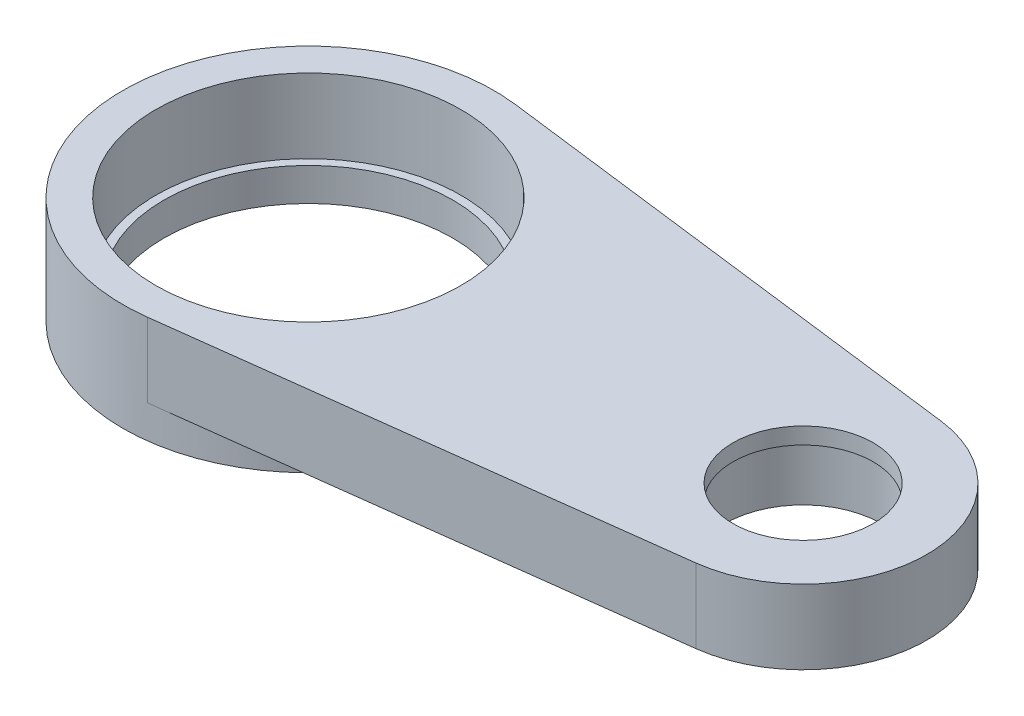
from build123d import *

# Parameters (mm, degrees)
SKETCH_1_R           = 22.5
SKETCH_1_R_2         = 17.5
EXTRUDE_1_DEPTH      = 8
SKETCH_2_R           = 22.5
SKETCH_2_R_2         = 18.5
EXTRUDE_2_DEPTH      = 5
EXTRUDE_START        = -9
EXTRUDE_3_DEPTH      = 9
CUT_EXTRUDE_START    = -4
SKETCH_7_R           = 18.5
CUT_EXTRUDE_4_DEPTH  = 4
SKETCH_13_R          = 9.5
CUT_EXTRUDE_9_DEPTH  = 7
SKETCH_14_R          = 8.5
CUT_EXTRUDE_10_DEPTH = 80.071170473


with BuildPart() as part:
    # 스케치1 → 보스-돌출1 (new body)
    with BuildSketch(Plane(origin=(0, 0, 0), x_dir=(1, 0, 0), z_dir=(0, 1, 0))):
        Circle(SKETCH_1_R)
        Circle(SKETCH_1_R_2, mode=Mode.SUBTRACT)
    extrude(amount=EXTRUDE_1_DEPTH)

    # 스케치2 → 보스-돌출2 (add)
    with BuildSketch(Plane(origin=(0, 8, 0), x_dir=(1, 0, 0), z_dir=(0, 1, 0))):
        Circle(SKETCH_2_R)
        Circle(SKETCH_2_R_2, mode=Mode.SUBTRACT)
    extrude(amount=EXTRUDE_2_DEPTH)

    # 스케치3 → 보스-돌출3 (add)
    with BuildSketch(Plane(origin=(0, 13, 0), x_dir=(1, 0, 0), z_dir=(0, 1, 0)).offset(EXTRUDE_START)):
        with BuildLine():
            Line((2.8125, 22.323526687), (61.875, 14.882351125))
            ThreePointArc((61.875, 14.882351125), (75, 0), (61.875, -14.882351125))
            Line((61.875, -14.882351125), (2.8125, -22.323526687))
            ThreePointArc((2.8125, -22.323526687), (22.5, 0), (2.8125, 22.323526687))
        make_face()
    extrude(amount=EXTRUDE_3_DEPTH)

    # 스케치7 → 컷-돌출4 (cut)
    with BuildSketch(Plane(origin=(0, 8, 0), x_dir=(1, 0, 0), z_dir=(0, 1, 0)).offset(CUT_EXTRUDE_START)):
        Circle(SKETCH_7_R)
    extrude(amount=CUT_EXTRUDE_4_DEPTH, mode=Mode.SUBTRACT)

    # 스케치13 → 컷-돌출9 (cut)
    with BuildSketch(Plane.XZ.offset(-4)):
        with Locations((60, 0)):
            Circle(SKETCH_13_R)
    extrude(amount=-CUT_EXTRUDE_9_DEPTH, mode=Mode.SUBTRACT)

    # 스케치14 → 컷-돌출10 (cut, through all)
    with BuildSketch(Plane.XZ.offset(-11)):
        with Locations((60, 0)):
            Circle(SKETCH_14_R)
    extrude(amount=-CUT_EXTRUDE_10_DEPTH, mode=Mode.SUBTRACT)


solid = part.part
